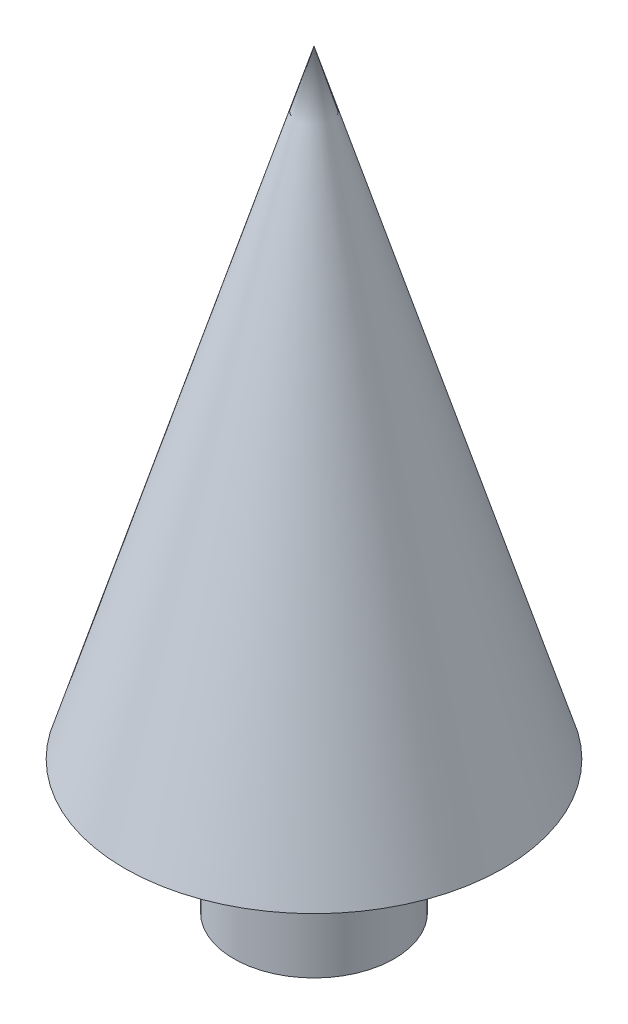
from build123d import *


with BuildPart() as part:
    # Sketch2 → Revolve1 (revolve)
    with BuildSketch(Plane.XY):
        Polygon((0, 0), (0, 150), (37.862993318, 26.563009577), (16.045269488, 26.563009577), (16.045269488, 0), align=None)
    revolve(axis=Axis((0, 0, 0), (0, 1, 0)))


solid = part.part
